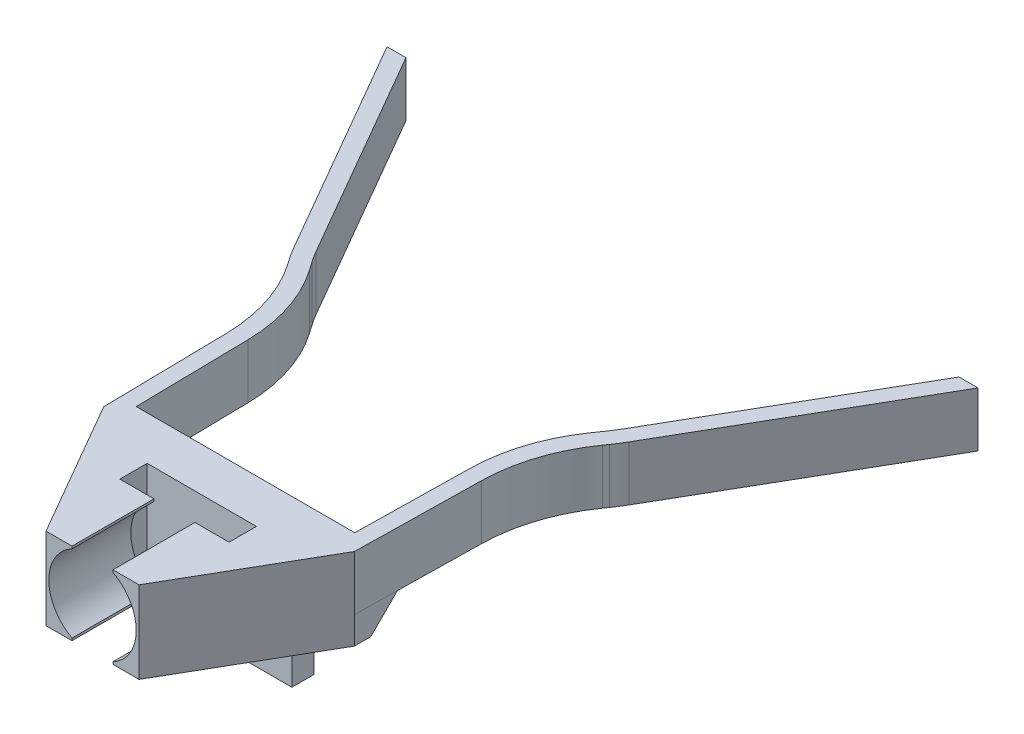
from build123d import *
from OCP.BRepFilletAPI import BRepFilletAPI_MakeChamfer

# Parameters (mm, degrees)
BOSS_EXTRUDE1_DEPTH             = 2
BOSS_EXTRUDE2_REACH             = 41.677
SKETCH2_W                       = 18.358473432
SKETCH2_H                       = 6
BOSS_EXTRUDE2_DIRECTION_2_DEPTH = 10
CUT_EXTRUDE1_DEPTH              = 8
CUT_EXTRUDE2_DEPTH              = 39.833672901
CUT_EXTRUDE2_DEPTH_BACK         = 39.833672901
SKETCH4_W                       = 8
SKETCH4_H                       = 2
CHAMFER1_SIZE                   = 2
CHAMFER2_SIZE                   = 10
CHAMFER2_SIZE2                  = 5.773502692
FILLET1_START                   = -2
FILLET1_DEPTH                   = 5
FILLET1_2_DEPTH                 = 4
BOSS_EXTRUDE3_START             = -6
SKETCH5_W                       = 10
SKETCH5_H                       = 1.6
BOSS_EXTRUDE3_DEPTH             = 10.5


with BuildPart() as part:
    # Sketch1 → Boss-Extrude1 (new, symmetric)
    with BuildSketch(Plane(origin=(0, 0, 0), x_dir=(1, 0, 0), z_dir=(0, 1, 0))):
        Polygon((-8, 0), (0, 0), (0, -1.2), (-9.179236716, -1.2), (-9.402843228, 11.610408514), (-12.023292949, 15.352798559), (-21.634559182, 32), (-20.248918536, 32), (-11.01025903, 15.998172342), (-8.209428877, 11.998172342), align=None)
    boss_extrude1 = extrude(amount=BOSS_EXTRUDE1_DEPTH, both=True)

    # Mirror1: Boss-Extrude1 across plane
    add(boss_extrude1.mirror(Plane(origin=(0, 2, 0), x_dir=(0, 0, 1), z_dir=(-1, 0, 0))))

    # Boss-Extrude2: up to this face of the body (flat: up to its plane)
    boss_extrude2_end = Plane(part.part.faces().sort_by_distance((0, 0, 0))[0])
    # Sketch2 → Boss-Extrude2 (add, up to the picked face)
    with BuildSketch(Plane.XY.offset(1.2), mode=Mode.PRIVATE) as boss_extrude2_sk1:
        with Locations((0, -1)):
            Rectangle(SKETCH2_W, SKETCH2_H)
    boss_extrude2_tool1 = split(extrude(boss_extrude2_sk1.sketch, amount=-BOSS_EXTRUDE2_REACH, mode=Mode.PRIVATE), bisect_by=boss_extrude2_end, keep=Keep.BOTH, mode=Mode.PRIVATE)
    add(boss_extrude2_tool1.solids().sort_by(Axis((0, -1, 1.2), (0, 0, -1)))[0])

    # Sketch2 → Boss-Extrude2 direction 2 (add)
    with BuildSketch(Plane.XY.offset(1.2)):
        with Locations((0, -1)):
            Rectangle(SKETCH2_W, SKETCH2_H)
    extrude(amount=BOSS_EXTRUDE2_DIRECTION_2_DEPTH)

    # Sketch3 → Cut-Extrude1 (cut)
    with BuildSketch(Plane.XY.offset(11.2)):
        with BuildLine():
            Line((-1.5, 1.826658805), (-1.5, 2))
            Line((-1.5, 2), (1.5, 2))
            Line((1.5, 2), (1.5, 1.826658805))
            ThreePointArc((1.5, 1.826658805), (3.2, -1), (1.5, -3.826658805))
            Line((1.5, -3.826658805), (1.5, -4))
            Line((1.5, -4), (-1.5, -4))
            Line((-1.5, -4), (-1.5, -3.826658805))
            ThreePointArc((-1.5, -3.826658805), (-3.2, -1), (-1.5, 1.826658805))
        make_face()
    extrude(amount=-CUT_EXTRUDE1_DEPTH, mode=Mode.SUBTRACT)

    # Sketch4 → Cut-Extrude2 (cut, two sides: drawn at the far end of the back side and taken through both)
    with BuildSketch(Plane(origin=(0, 0, 0), x_dir=(1, 0, 0), z_dir=(0, 1, 0)).offset(-CUT_EXTRUDE2_DEPTH_BACK)):
        with Locations((0, -4.2)):
            Rectangle(SKETCH4_W, SKETCH4_H)
    extrude(amount=CUT_EXTRUDE2_DEPTH + CUT_EXTRUDE2_DEPTH_BACK, mode=Mode.SUBTRACT)

    # Chamfer1
    chamfer1_edges = [part.edges().sort_by_distance(p)[0] for p in [
        (8.589618358, -2, 0),
        (-8.589618358, -2, 0),
    ]]
    chamfer(chamfer1_edges, length=CHAMFER1_SIZE - 0.0001)  # a hair under: the kernel refuses the full size

    # Chamfer2: one chamfer whose edges measure the first distance from different faces: ONE call of the kernel's chamfer builder (chamfer() names one face for all edges)
    chamfer2_edges_1 = [part.edges().sort_by_distance(p)[0] for p in [
        (9.179236716, -1, 11.2),
    ]]
    chamfer2_side_1 = [part.faces().sort_by_distance(p)[0] for p in [
        (9.179236716, -1.126288177, 5.77807488),
    ]]
    chamfer2_edges_2 = [part.edges().sort_by_distance(p)[0] for p in [
        (-9.179236716, -1, 11.2),
    ]]
    chamfer2_side_2 = [part.faces().sort_by_distance(p)[0] for p in [
        (-9.179236716, -1.126288177, 5.77807488),
    ]]
    chamfer2 = BRepFilletAPI_MakeChamfer(part.part.solid().wrapped)
    for e in chamfer2_edges_1:
        chamfer2.Add(CHAMFER2_SIZE, CHAMFER2_SIZE2, e.wrapped, chamfer2_side_1[0].wrapped)  # the first distance lies on this face
    for e in chamfer2_edges_2:
        chamfer2.Add(CHAMFER2_SIZE, CHAMFER2_SIZE2, e.wrapped, chamfer2_side_2[0].wrapped)  # the first distance lies on this face
    add(Compound.cast(chamfer2.Shape()), mode=Mode.REPLACE)

    # Fillet1: read off the stored shape, not the designer's step
    # Fillet1 outline → Fillet1 (cut)
    with BuildSketch(Plane(origin=(0, 0, 0), x_dir=(1, 0, 0), z_dir=(0, 1, 0)).offset(FILLET1_START)):
        with BuildLine():
            Line((12.023292949, 15.352798559), (12.285258606, 15.806536388))
            ThreePointArc((12.285258606, 15.806536388), (12.013651111, 15.358941087), (11.722778292, 14.923619151))
            Line((11.722778292, 14.923619151), (12.023292949, 15.352798559))
        make_face()
        with BuildLine():
            ThreePointArc((8.145400044, 8.329962936), (8.73089419, 11.828737991), (10.313747854, 15.003451295))
            Line((10.313747854, 15.003451295), (8.209428877, 11.998172342))
            Line((8.209428877, 11.998172342), (8.145400044, 8.329962936))
        make_face()
        with BuildLine():
            Line((-12.023292949, 15.352798559), (-11.722778292, 14.923619151))
            ThreePointArc((-11.722778292, 14.923619151), (-12.013651111, 15.358941087), (-12.285258606, 15.806536388))
            Line((-12.285258606, 15.806536388), (-12.023292949, 15.352798559))
        make_face()
        with BuildLine():
            Line((-8.209428877, 11.998172342), (-10.313747854, 15.003451295))
            ThreePointArc((-10.313747854, 15.003451295), (-8.73089419, 11.828737991), (-8.145400044, 8.329962936))
            Line((-8.145400044, 8.329962936), (-8.209428877, 11.998172342))
        make_face()
    extrude(amount=FILLET1_DEPTH, mode=Mode.SUBTRACT)

    # Fillet1 2 outline → Fillet1 2 (add)
    with BuildSketch(Plane(origin=(0, 0, 0), x_dir=(1, 0, 0), z_dir=(0, 1, 0)).offset(FILLET1_START)):
        with BuildLine():
            ThreePointArc((9.338814395, 7.942199107), (9.924308541, 11.440974162), (11.507162205, 14.615687466))
            Line((11.507162205, 14.615687466), (9.402843228, 11.610408514))
            Line((9.402843228, 11.610408514), (9.338814395, 7.942199107))
        make_face()
        with BuildLine():
            ThreePointArc((11.272224688, 16.45191017), (11.000617192, 16.00431487), (10.709744374, 15.568992934))
            Line((10.709744374, 15.568992934), (11.01025903, 15.998172342))
            Line((11.01025903, 15.998172342), (11.272224688, 16.45191017))
        make_face()
        with BuildLine():
            Line((-9.402843228, 11.610408514), (-11.507162205, 14.615687466))
            ThreePointArc((-11.507162205, 14.615687466), (-9.924308541, 11.440974162), (-9.338814395, 7.942199107))
            Line((-9.338814395, 7.942199107), (-9.402843228, 11.610408514))
        make_face()
        with BuildLine():
            ThreePointArc((-10.709744374, 15.568992934), (-11.000617192, 16.00431487), (-11.272224688, 16.45191017))
            Line((-11.272224688, 16.45191017), (-11.01025903, 15.998172342))
            Line((-11.01025903, 15.998172342), (-10.709744374, 15.568992934))
        make_face()
    extrude(amount=FILLET1_2_DEPTH)

    # Sketch5 → Boss-Extrude3 (add)
    with BuildSketch(Plane.XZ.offset(4).offset(BOSS_EXTRUDE3_START)):
        with Locations((0, 0.8)):
            Rectangle(SKETCH5_W, SKETCH5_H)
    extrude(amount=BOSS_EXTRUDE3_DEPTH)


solid = part.part
